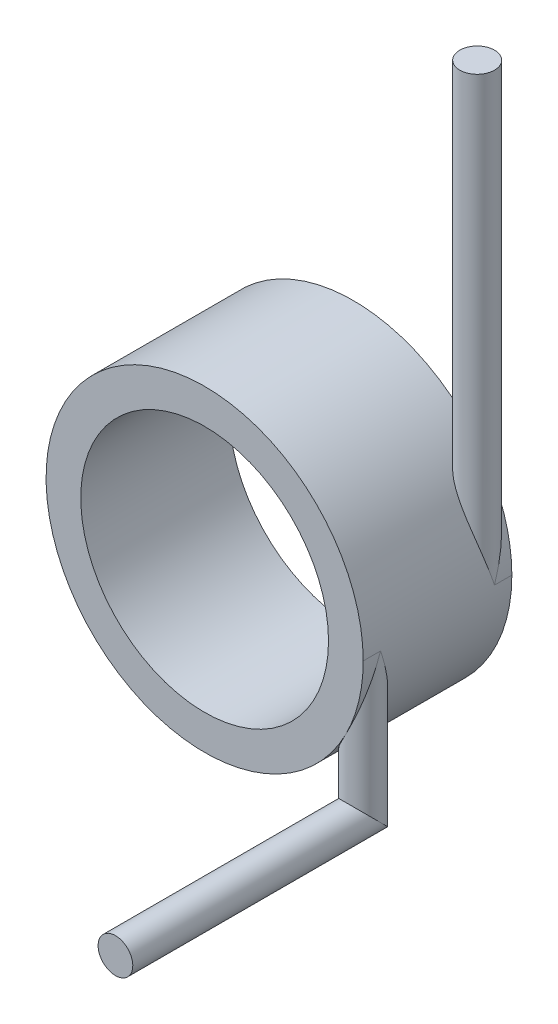
from build123d import *
from build123d.topology import SkipClean

# Parameters (mm, degrees)
SKETCH1_R           = 8.128
SKETCH1_R_2         = 6.35
BOSS_EXTRUDE1_DEPTH = 7.62
SKETCH2_R           = 0.889
BOSS_EXTRUDE2_DEPTH = 3.81
SKETCH2_3_R         = 0.889
BOSS_EXTRUDE3_DEPTH = 22.86
SKETCH11_R          = 0.889


with BuildPart() as part:
    # Sketch1 → Boss-Extrude1 (new body)
    with BuildSketch(Plane.XY):
        Circle(SKETCH1_R)
        Circle(SKETCH1_R_2, mode=Mode.SUBTRACT)
    extrude(amount=BOSS_EXTRUDE1_DEPTH)

    # Sketch2 → Boss-Extrude2 (add)
    with SkipClean():  # the faces are left unmerged after this step: merging them gives an invalid solid
        with BuildSketch(Plane(origin=(0, 0, 0), x_dir=(1, 0, 0), z_dir=(0, 1, 0))):
            with Locations((7.239, -6.731)):
                Circle(SKETCH2_R)
        extrude(amount=-BOSS_EXTRUDE2_DEPTH)

    # Sketch2<3> → Boss-Extrude3 (add)
    with SkipClean():  # the faces are left unmerged after this step: merging them gives an invalid solid
        with BuildSketch(Plane(origin=(0, 0, 0), x_dir=(1, 0, 0), z_dir=(0, 1, 0))):
            with Locations((7.239, -0.889)):
                Circle(SKETCH2_3_R)
        extrude(amount=BOSS_EXTRUDE3_DEPTH)

    # Sweep4: sweep along a path in Sketch10
    with SkipClean():  # the faces are left unmerged after this step: merging them gives an invalid solid
        with BuildLine(Plane(origin=(7.239, 0, 0), x_dir=(0, 0, -1), z_dir=(1, 0, 0))) as sweep4_path:
            Line((-6.731, -3.81), (-6.731, -7.62))
            Line((-6.731, -7.62), (-19.431, -7.62))
        # Sketch11 → Sweep4 (sweep)
        with BuildSketch(Plane.XZ.offset(3.81)):
            with Locations((7.239, 6.731)):
                Circle(SKETCH11_R)
        sweep(path=sweep4_path.line, transition=Transition.RIGHT)


solid = part.part
